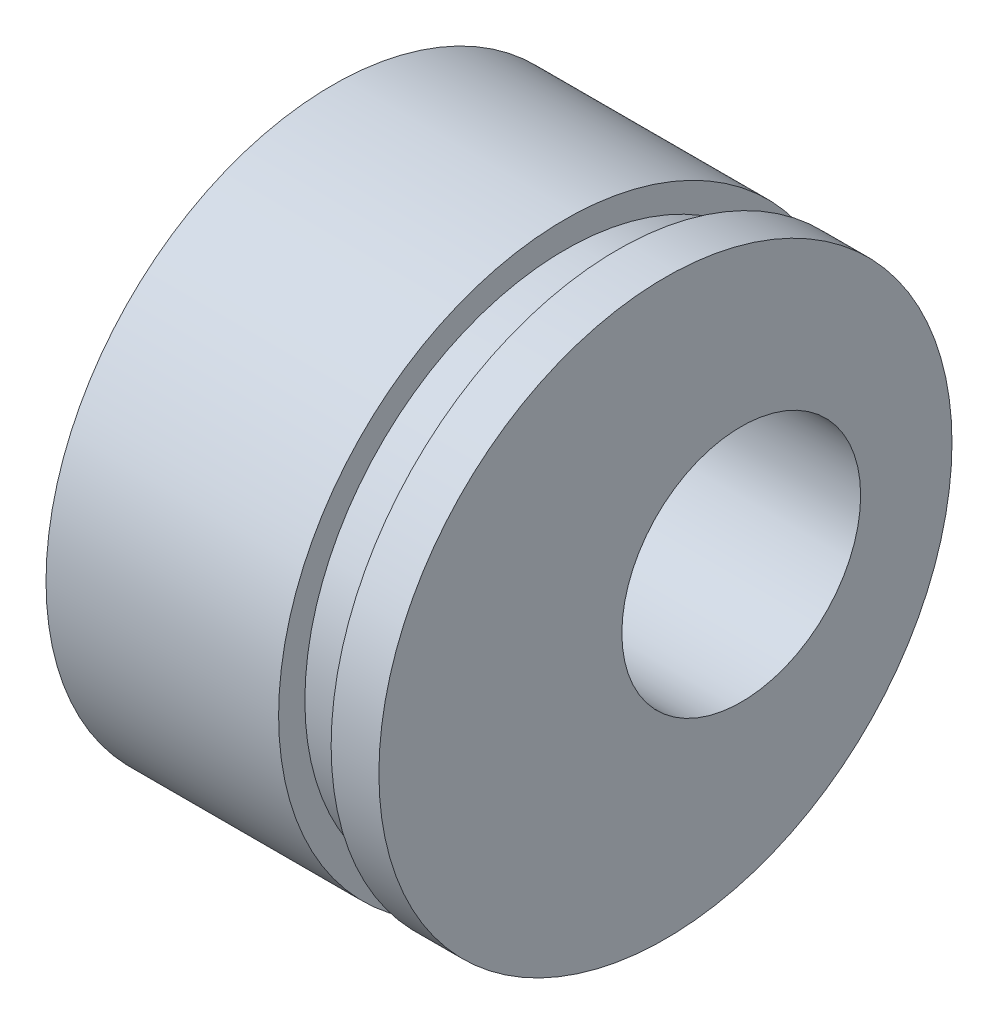
from build123d import *

# Parameters (mm, degrees)
SKETCH5_R          = 2.499999953
CUT_EXTRUDE1_DEPTH = 16.506928009


with BuildPart() as part:
    # Sketch3 → Revolve1 (revolve)
    with BuildSketch(Plane.XY):
        Polygon((12.979399746, 2.999999969), (12.979399746, 2.499999953), (12.979399746, 0), (6.009399716, 0), (6.009399716, 2.499999953), (6.009399716, 5.999999938), (9.97939965, 5.999999938), (10.879399628, 5.999999938), (10.879399628, 5.450000022), (11.979399714, 5.450000022), (11.979399714, 5.999999938), (12.979399746, 5.999999938), align=None)
    revolve(axis=Axis((6.009399716, 0, 0), (1, 0, 0)))

    # Sketch5 → Cut-Extrude1 (cut, through all)
    with BuildSketch(Plane(origin=(0, 0, 0), x_dir=(0, 0, -1), z_dir=(1, 0, 0))):
        with Locations((1.5875, 0)):
            Circle(SKETCH5_R)
    extrude(amount=CUT_EXTRUDE1_DEPTH, mode=Mode.SUBTRACT)


solid = part.part
